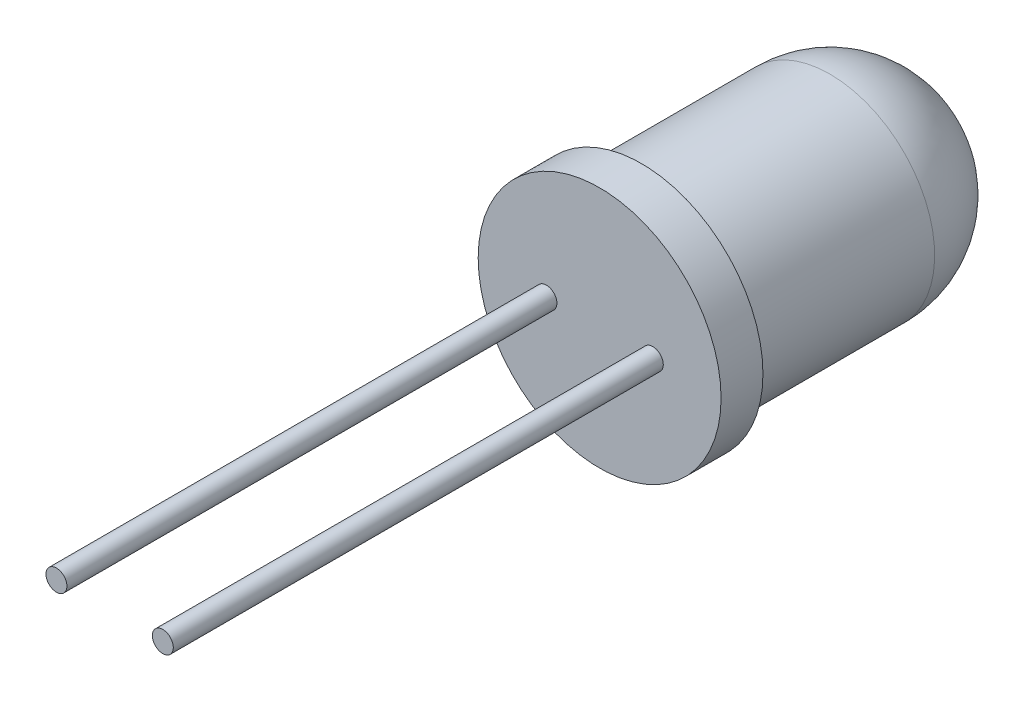
from build123d import *

# Parameters (mm, degrees)
SKETCH_1_R      = 2.5
EXTRUDE_1_DEPTH = 5.5
SKETCH_2_R      = 2.9
EXTRUDE_2_DEPTH = 1
SKETCH_3_R      = 0.25
EXTRUDE_3_DEPTH = 12.7


with BuildPart() as part:
    # 草图1 → 拉伸1 (new body)
    with BuildSketch(Plane.XY):
        Circle(SKETCH_1_R)
    extrude(amount=EXTRUDE_1_DEPTH)

    # 草图2 → 拉伸2 (add)
    with BuildSketch(Plane.XY.offset(5.5)):
        Circle(SKETCH_2_R)
    extrude(amount=-EXTRUDE_2_DEPTH)

    # 草图3 → 拉伸3 (add)
    with BuildSketch(Plane(origin=(0, 0, 4.5), x_dir=(-1, 0, 0), z_dir=(0, 0, -1))):
        with Locations((-1.27, 0)):
            Circle(SKETCH_3_R)
        with Locations((1.27, 0)):
            Circle(SKETCH_3_R)
    extrude(amount=-EXTRUDE_3_DEPTH)

    # 草图5 → 旋转2 (revolve)
    with BuildSketch(Plane(origin=(0, 0, 0), x_dir=(0, 0, -1), z_dir=(1, 0, 0))):
        with BuildLine():
            Line((0, 2.5), (0, 0))
            Line((0, 0), (2.5, 0))
            ThreePointArc((2.5, 0), (1.767766953, 1.767766953), (0, 2.5))
        make_face()
    revolve(axis=Axis((0, 0, -2.5), (0, 0, 1)))


solid = part.part
